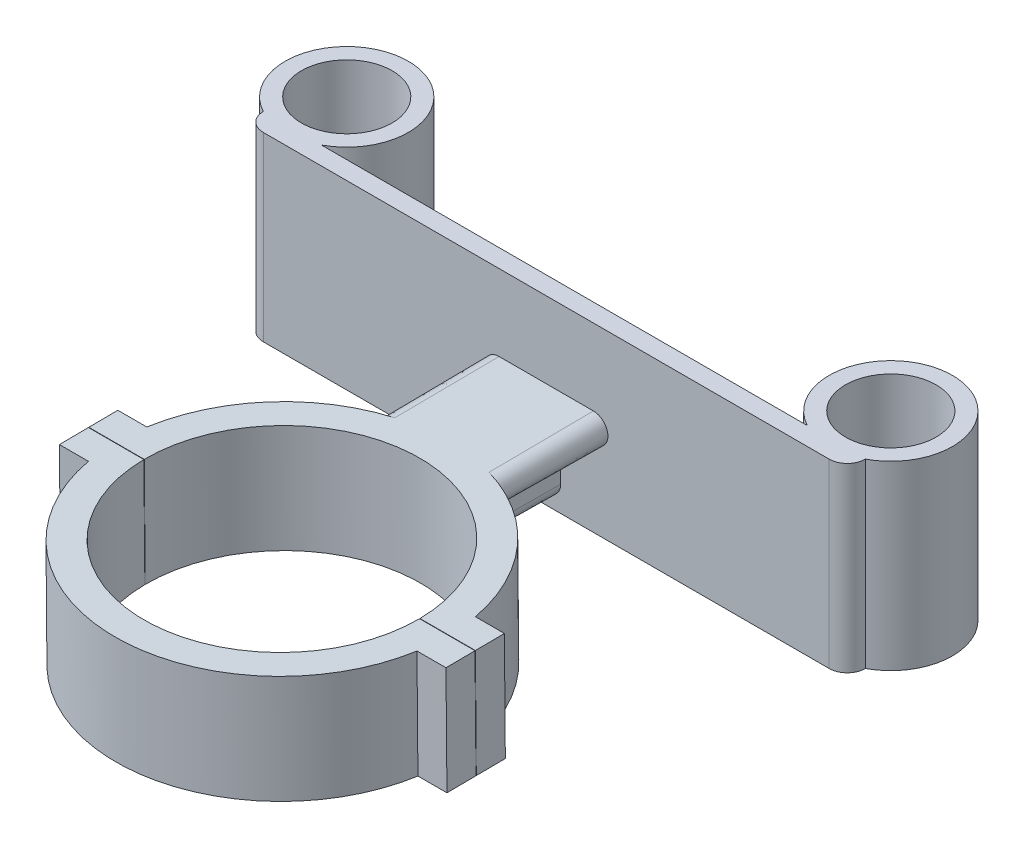
from build123d import *

# Parameters (mm, degrees)
SKETCH_1_W                  = 166
SKETCH_1_H                  = 50
EXTRUDE_1_DEPTH             = 5
EXTRUDE_4_REACH             = 88.827
SKETCH_4_R                  = 12.5
EXTRUDE_4_DIRECTION_2_REACH = 88.827
FILLET_1_R                  = 5
EXTRUDE_2_DEPTH             = 30
EXTRUDE_2_TAPER             = 0.5
EXTRUDE_3_DEPTH             = 30


with BuildPart() as part:
    # Эскиз1 → Бобышка-Вытянуть1 (new body)
    with BuildSketch(Plane.XY):
        Rectangle(SKETCH_1_W, SKETCH_1_H)
    extrude(amount=EXTRUDE_1_DEPTH)

    # Бобышка-Вытянуть4: up to this face of the body (flat: up to its plane)
    extrude_4_end = Plane(part.part.faces().sort_by_distance((0, 25, 2.5))[0])
    # Эскиз4 → Бобышка-Вытянуть4 (add, up to the picked face)
    with BuildSketch(Plane(origin=(0, 0, 0), x_dir=(1, 0, 0), z_dir=(0, 1, 0)), mode=Mode.PRIVATE) as extrude_4_sk1:
        with BuildLine():
            Line((-83, 0), (-67, 0))
            ThreePointArc((-67, 0), (-75, 32), (-83, 0))
        make_face()
        with Locations(Location((-75, 15, 0), (0, 0, 90))):
            Circle(SKETCH_4_R, mode=Mode.SUBTRACT)
    extrude_4_tool1 = split(extrude(extrude_4_sk1.sketch, amount=EXTRUDE_4_REACH, mode=Mode.PRIVATE), bisect_by=extrude_4_end, keep=Keep.BOTH, mode=Mode.PRIVATE)
    # Эскиз4 → Бобышка-Вытянуть4 (add, up to the picked face)
    with BuildSketch(Plane(origin=(0, 0, 0), x_dir=(1, 0, 0), z_dir=(0, 1, 0)), mode=Mode.PRIVATE) as extrude_4_sk2:
        with BuildLine():
            Line((83, 0), (67, 0))
            ThreePointArc((67, 0), (75, 32), (83, 0))
        make_face()
        with Locations(Location((75, 15, 0), (0, 0, 90))):
            Circle(SKETCH_4_R, mode=Mode.SUBTRACT)
    extrude_4_tool2 = split(extrude(extrude_4_sk2.sketch, amount=EXTRUDE_4_REACH, mode=Mode.PRIVATE), bisect_by=extrude_4_end, keep=Keep.BOTH, mode=Mode.PRIVATE)
    add(extrude_4_tool1.solids().sort_by(Axis((-75, 0, -31.533095), (0, 1, 0)))[0])
    add(extrude_4_tool2.solids().sort_by(Axis((75, 0, -31.533095), (0, 1, 0)))[0])

    # Бобышка-Вытянуть4 direction 2: up to this face of the body (flat: up to its plane)
    extrude_4_direction_2_end = Plane(part.part.faces().sort_by_distance((0, -25, 2.5))[0])
    # Эскиз4 → Бобышка-Вытянуть4 direction 2 (add, up to the picked face)
    with BuildSketch(Plane(origin=(0, 0, 0), x_dir=(1, 0, 0), z_dir=(0, 1, 0)), mode=Mode.PRIVATE) as extrude_4_direction_2_sk1:
        with BuildLine():
            Line((-83, 0), (-67, 0))
            ThreePointArc((-67, 0), (-75, 32), (-83, 0))
        make_face()
        with Locations(Location((-75, 15, 0), (0, 0, 90))):
            Circle(SKETCH_4_R, mode=Mode.SUBTRACT)
    extrude_4_direction_2_tool1 = split(extrude(extrude_4_direction_2_sk1.sketch, amount=-EXTRUDE_4_DIRECTION_2_REACH, mode=Mode.PRIVATE), bisect_by=extrude_4_direction_2_end, keep=Keep.BOTH, mode=Mode.PRIVATE)
    # Эскиз4 → Бобышка-Вытянуть4 direction 2 (add, up to the picked face)
    with BuildSketch(Plane(origin=(0, 0, 0), x_dir=(1, 0, 0), z_dir=(0, 1, 0)), mode=Mode.PRIVATE) as extrude_4_direction_2_sk2:
        with BuildLine():
            Line((83, 0), (67, 0))
            ThreePointArc((67, 0), (75, 32), (83, 0))
        make_face()
        with Locations(Location((75, 15, 0), (0, 0, 90))):
            Circle(SKETCH_4_R, mode=Mode.SUBTRACT)
    extrude_4_direction_2_tool2 = split(extrude(extrude_4_direction_2_sk2.sketch, amount=-EXTRUDE_4_DIRECTION_2_REACH, mode=Mode.PRIVATE), bisect_by=extrude_4_direction_2_end, keep=Keep.BOTH, mode=Mode.PRIVATE)
    add(extrude_4_direction_2_tool1.solids().sort_by(Axis((-75, 0, -31.533095), (0, -1, 0)))[0])
    add(extrude_4_direction_2_tool2.solids().sort_by(Axis((75, 0, -31.533095), (0, -1, 0)))[0])

    # Скругление1
    fillet_1_edges = [part.edges().sort_by_distance(p)[0] for p in [
        (83, 0, 5),
        (-83, 0, 5),
    ]]
    fillet(fillet_1_edges, radius=FILLET_1_R - 0.0001)  # a hair under: the kernel refuses the full size

    # Эскиз2 → Бобышка-Вытянуть2 (add)
    with BuildSketch(Plane.XY.offset(5)):
        with BuildLine():
            ThreePointArc((-13, 4), (-17, 0), (-13, -4))
            Line((-13, -4), (-5, -4))
            ThreePointArc((-5, -4), (-4.292893219, -4.292893219), (-4, -5))
            Line((-4, -5), (-4, -18))
            ThreePointArc((-4, -18), (0, -22), (4, -18))
            Line((4, -18), (4, -5))
            ThreePointArc((4, -5), (4.292893219, -4.292893219), (5, -4))
            Line((5, -4), (13, -4))
            ThreePointArc((13, -4), (17, 0), (13, 4))
            Line((13, 4), (-13, 4))
        make_face()
    extrude(amount=EXTRUDE_2_DEPTH, taper=EXTRUDE_2_TAPER)

    # Эскиз3 → Бобышка-Вытянуть3 (add)
    with BuildSketch(Plane(origin=(0, 4.043326406, 0.035285575), x_dir=(1, 0, 0), z_dir=(0, 0.9999619230641713, 0.008726535498373954))):
        with BuildLine():
            Line((37.999967105, -77.795289998), (53.290147935, -77.795289998))
            Line((53.290147935, -77.795289998), (53.290147935, -69.795289998))
            Line((53.290147935, -69.795289998), (45.290147935, -69.795289998))
            ThreePointArc((45.290147935, -69.795289998), (0, -31.845289998), (-45.290147935, -69.795289998))
            Line((-45.290147935, -69.795289998), (-53.290147935, -69.795289998))
            Line((-53.290147935, -69.795289998), (-53.290147935, -77.795289998))
            Line((-53.290147935, -77.795289998), (-37.999967105, -77.795289998))
            ThreePointArc((-37.999967105, -77.795289998), (0, -39.845289998), (37.999967105, -77.795289998))
        make_face()
        with BuildLine():
            Line((-53.290147935, -77.895289998), (-37.999967105, -77.895289998))
            ThreePointArc((-37.999967105, -77.895289998), (0, -115.845289998), (37.999967105, -77.895289998))
            Line((37.999967105, -77.895289998), (53.290147935, -77.895289998))
            Line((53.290147935, -77.895289998), (53.290147935, -85.895289998))
            Line((53.290147935, -85.895289998), (45.290147935, -85.895289998))
            ThreePointArc((45.290147935, -85.895289998), (0, -123.845289998), (-45.290147935, -85.895289998))
            Line((-45.290147935, -85.895289998), (-53.290147935, -85.895289998))
            Line((-53.290147935, -85.895289998), (-53.290147935, -77.895289998))
        make_face()
    extrude(amount=-EXTRUDE_3_DEPTH)


with BuildPart() as extrude_3_piece_1:
    # of the separate pieces the step leaves, piece 1, a body of its own (extrude_3_pieces)
    add(part.part.solids().sort_by_distance((-83, 25, 0.0001))[0])


with BuildPart() as extrude_3_piece_2:
    # of the separate pieces the step leaves, piece 2, a body of its own (extrude_3_pieces)
    add(part.part.solids().sort_by_distance((-45.290147935, 3.293758109, 85.927304944))[0])


solid = Compound([extrude_3_piece_1.part, extrude_3_piece_2.part])
